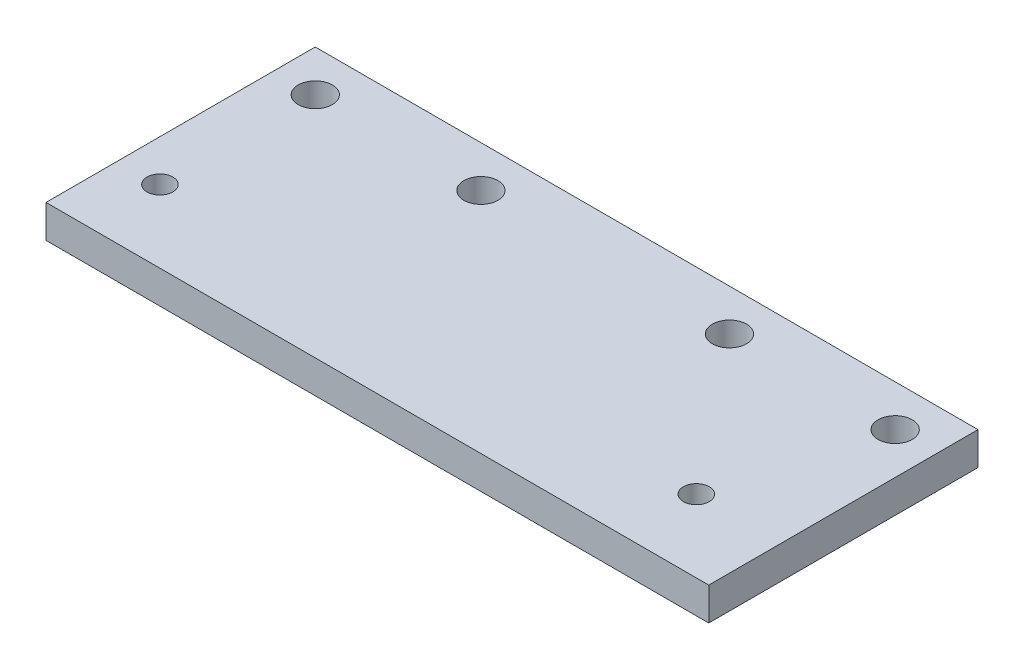
from build123d import *

# Parameters (mm, degrees)
SKETCH1_R           = 1.65
SKETCH1_R_2         = 1.25
BOSS_EXTRUDE1_DEPTH = 3.175


with BuildPart() as part:
    # Sketch1 → Boss-Extrude1 (new body)
    with BuildSketch(Plane(origin=(0, 0, 0), x_dir=(1, 0, 0), z_dir=(0, 1, 0))):
        Polygon((0, 7), (0, 0), (64, 0), (64, 7), (64, 26), (0, 26), align=None)
        with Locations((4, 22)):
            Circle(SKETCH1_R, mode=Mode.SUBTRACT)
        with Locations((20, 22)):
            Circle(SKETCH1_R, mode=Mode.SUBTRACT)
        with Locations((44, 22)):
            Circle(SKETCH1_R, mode=Mode.SUBTRACT)
        with Locations((60, 22)):
            Circle(SKETCH1_R, mode=Mode.SUBTRACT)
        with Locations((4, 7)):
            Circle(SKETCH1_R_2, mode=Mode.SUBTRACT)
        with Locations((55.8, 7)):
            Circle(SKETCH1_R_2, mode=Mode.SUBTRACT)
    extrude(amount=BOSS_EXTRUDE1_DEPTH)


solid = part.part
